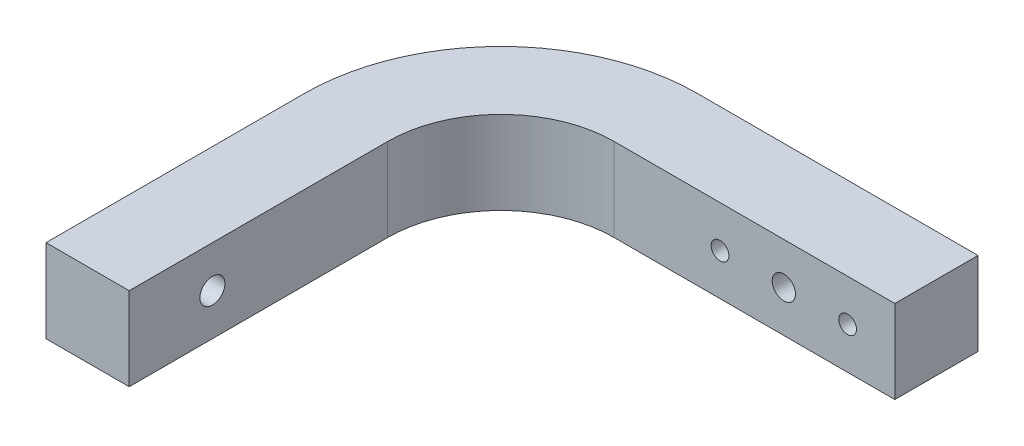
from build123d import *

# Parameters (mm, degrees)
BOSS_EXTRUDE1_DEPTH      = 7.5
BOSS_EXTRUDE1_DEPTH_BACK = 7.5
CUT_EXTRUDE1_DEPTH       = 109.725571969
CUT_EXTRUDE1_DEPTH_BACK  = 109.725571969
SKETCH2_R                = 2.25
SKETCH3_R                = 2.1
SKETCH3_R_2              = 1.6
CUT_EXTRUDE2_DEPTH       = 106.528432188


with BuildPart() as part:
    # Sketch1 → Boss-Extrude1 (new, two sides: drawn at the far end of the back side and taken through both)
    with BuildSketch(Plane(origin=(0, 0, 0), x_dir=(1, 0, 0), z_dir=(0, 1, 0)).offset(-BOSS_EXTRUDE1_DEPTH_BACK)):
        with BuildLine():
            Line((-66, -35.4), (-66, -82))
            Line((-66, -82), (-51, -82))
            Line((-51, -82), (-51, -35.4))
            ThreePointArc((-51, -35.4), (-45.024978336, -20.975021664), (-30.6, -15))
            Line((-30.6, -15), (20, -15))
            Line((20, -15), (20, 0))
            Line((20, 0), (-30.6, 0))
            ThreePointArc((-30.6, 0), (-55.631580054, -10.368419946), (-66, -35.4))
        make_face()
    extrude(amount=BOSS_EXTRUDE1_DEPTH + BOSS_EXTRUDE1_DEPTH_BACK)

    # Sketch2 → Cut-Extrude1 (cut, two sides: drawn at the far end of the back side and taken through both)
    with BuildSketch(Plane.ZY.offset(51).offset(-CUT_EXTRUDE1_DEPTH_BACK)):
        with Locations((67, 0)):
            Circle(SKETCH2_R)
    extrude(amount=CUT_EXTRUDE1_DEPTH + CUT_EXTRUDE1_DEPTH_BACK, mode=Mode.SUBTRACT)

    # Sketch3 → Cut-Extrude2 (cut, through all)
    with BuildSketch(Plane(origin=(0, 0, 0), x_dir=(-1, 0, 0), z_dir=(0, 0, -1))):
        Circle(SKETCH3_R)
        with Locations((-11.5, 0)):
            Circle(SKETCH3_R_2)
        with Locations((11.5, 0)):
            Circle(SKETCH3_R_2)
    extrude(amount=-CUT_EXTRUDE2_DEPTH, mode=Mode.SUBTRACT)


solid = part.part
